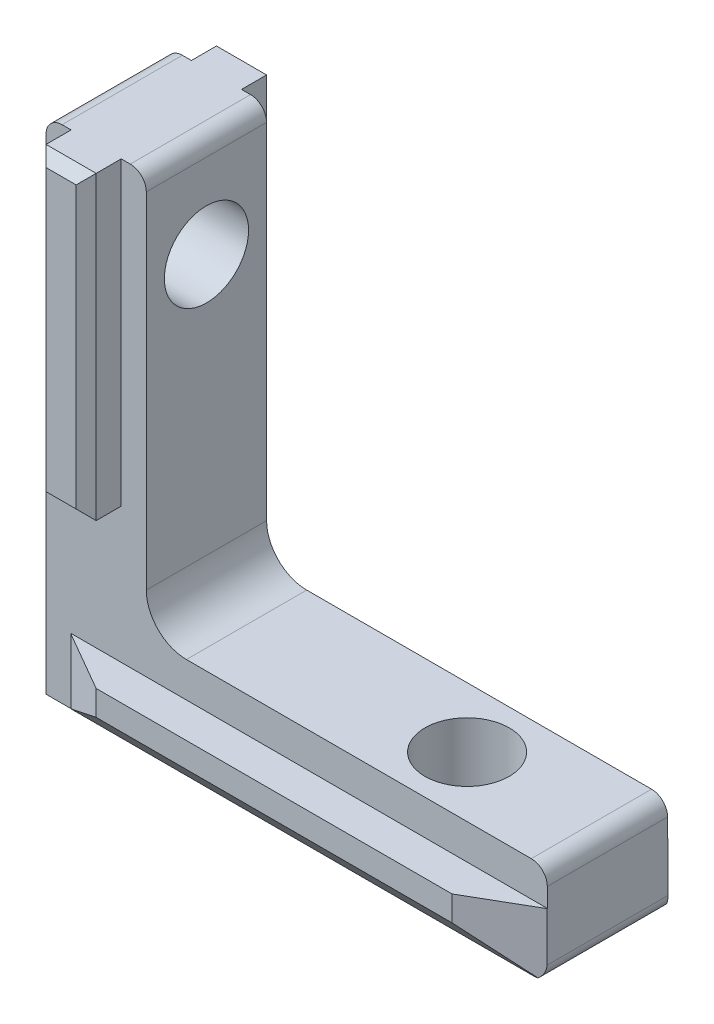
from build123d import *

# Parameters (mm, degrees)
EXTRUDE1_DEPTH        = 3
EXTRUDE1_DEPTH_BACK   = 3
SKETCH2_W             = 2.5
SKETCH2_H             = 15
SKETCH2_W_2           = 23.75
SKETCH2_H_2           = 3.25
EXTRUDE2_DEPTH        = 1.75
CHAMFER1_SIZE         = 3
CHAMFER1_SIZE2        = 1.732050808
CHAMFER2_SIZE         = 2
CHAMFER2_SIZE2        = 1.738573476
CHAMFER3_SIZE         = 0.5
FILLET1_R             = 0.8
FILETE1_R             = 2
FURO_ROSCADO_DE_M51_D = 4.2
FURO_ROSCADO_DE_M52_D = 4.2


# Read off the part's stored shape, not the designer's step: Mirror1
with BuildPart() as part:
    # Sketch1 → Extrude1 (new, two sides: drawn at the far end of the back side and taken through both)
    with BuildSketch(Plane.XY.offset(-EXTRUDE1_DEPTH_BACK)):
        Polygon((0, 0), (0, 20), (-5, 20), (-5, -5), (20, -5), (20, 0), align=None)
    extrude(amount=EXTRUDE1_DEPTH + EXTRUDE1_DEPTH_BACK)

    # Sketch2 → Extrude2 (add)
    with BuildSketch(Plane.XY.offset(3)):
        with Locations((-2.5, 12.5)):
            Rectangle(SKETCH2_W, SKETCH2_H)
        with Locations((8.125, -3.375)):
            Rectangle(SKETCH2_W_2, SKETCH2_H_2)
    extrude(amount=EXTRUDE2_DEPTH)

    # Chamfer1
    chamfer1_edges = [part.edges().sort_by_distance(p)[0] for p in [
        (20, -3.375, 4.75),
        (-3.75, -3.375, 4.75),
    ]]
    chamfer1_side = [part.faces().sort_by_distance(p)[0] for p in [
        (8.125, -3.375, 4.75),
    ]]
    chamfer(chamfer1_edges, length=CHAMFER1_SIZE, length2=CHAMFER1_SIZE2, reference=chamfer1_side[0])

    # Chamfer2
    chamfer2_edges = [part.edges().sort_by_distance(p)[0] for p in [
        (8.125, -5, 4.75),
    ]]
    chamfer2_side = [part.faces().sort_by_distance(p)[0] for p in [
        (8.125, -3.375, 4.75),
    ]]
    chamfer(chamfer2_edges, length=CHAMFER2_SIZE, length2=CHAMFER2_SIZE2, reference=chamfer2_side[0])

    # Chamfer3
    chamfer3_edges = [part.edges().sort_by_distance(p)[0] for p in [
        (-2.5, 20, 4.75),
        (-1.25, 12.5, 4.75),
        (-2.5, 5, 4.75),
        (-3.75, 12.5, 4.75),
    ]]
    chamfer(chamfer3_edges, length=CHAMFER3_SIZE)

    # Mirror1: part across plane


with BuildPart() as part_1:
    add(part.part)
    add(part.part.mirror(Plane.XY))

    # Fillet1
    fillet1_edges = [part_1.edges().sort_by_distance(p)[0] for p in [
        (-5, 20, 0),
        (20, -5, 0),
        (20, 0, 0),
        (0, 20, 0),
    ]]
    fillet(fillet1_edges, radius=FILLET1_R)

    # Filete1
    filete1_edges = [part_1.edges().sort_by_distance(p)[0] for p in [
        (0, 0, 0),
    ]]
    fillet(filete1_edges, radius=FILETE1_R)

    # Furo roscado de M51 (through all)
    with Locations(Plane(origin=(0, 0, 0), x_dir=(1, 0, 0), z_dir=(0, 1, 0))):
        with Locations((13, 0)):
            Hole(FURO_ROSCADO_DE_M51_D / 2)

    # Furo roscado de M52 (through all)
    with Locations(Plane(origin=(0, 0, 0), x_dir=(0, 0, -1), z_dir=(1, 0, 0))):
        with Locations((0, 15)):
            Hole(FURO_ROSCADO_DE_M52_D / 2)


solid = part_1.part
